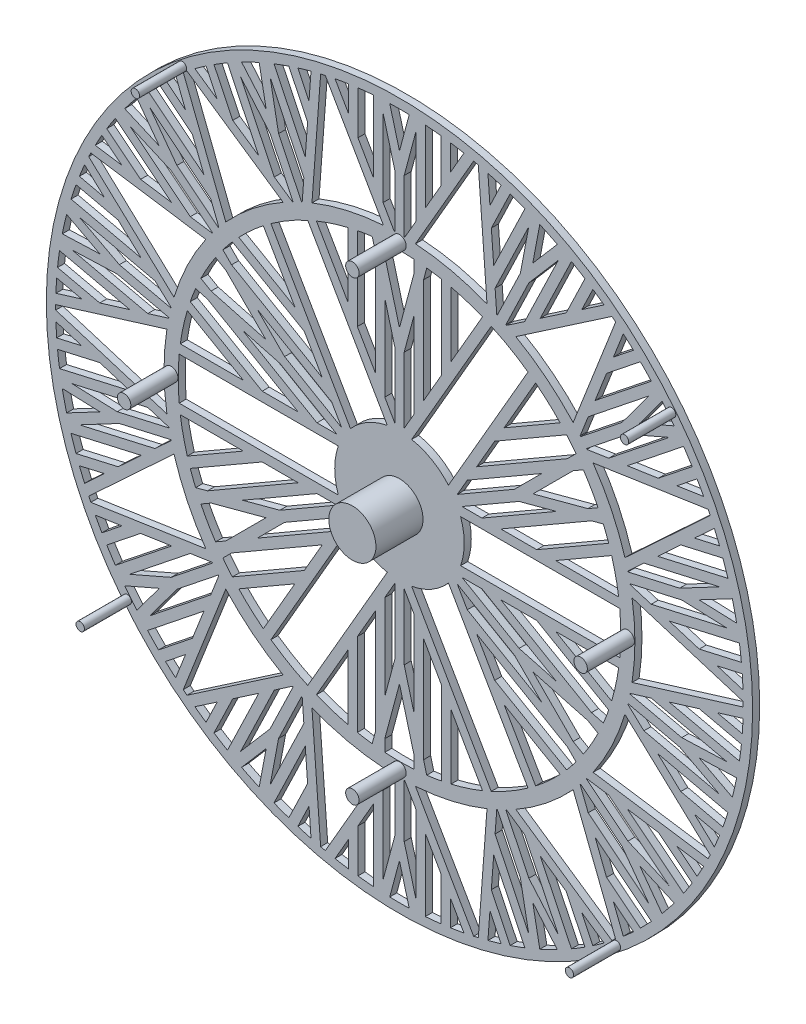
from build123d import *

# Parameters (mm, degrees)
BOSS_EXTRUDE1_OUTLINE_R = 75
BOSS_EXTRUDE1_DEPTH     = 1.5
SKETCH3_R               = 5
SKETCH3_R_2             = 1.426733154
SKETCH3_R_3             = 0.885664415
BOSS_EXTRUDE2_DEPTH     = 10


# Read off the part's stored shape, not the designer's step: Boss-Extrude1
with BuildPart() as part:
    # Boss-Extrude1 outline → Boss-Extrude1 (new body)
    with BuildSketch(Plane.XY):
        Circle(BOSS_EXTRUDE1_OUTLINE_R)
        with BuildLine():
            ThreePointArc((-41.071596258, -60.350012269), (-42.264664679, -59.520568878), (-43.440987533, -58.667543004))
            Line((-43.440987533, -58.667543004), (-38.70706267, -55.440007682))
            Line((-38.70706267, -55.440007682), (-41.071596258, -60.350012269))
        make_face(mode=Mode.SUBTRACT)
        with BuildLine():
            Line((-45.436879204, -50.073158084), (-47.530096096, -55.406587741))
            ThreePointArc((-47.530096096, -55.406587741), (-48.62349129, -54.449573871), (-49.697621503, -53.470986684))
            Line((-49.697621503, -53.470986684), (-45.436879204, -50.073158084))
        make_face(mode=Mode.SUBTRACT)
        with BuildLine():
            ThreePointArc((-55.759999279, -47.114992098), (-57.07369822, -45.514755536), (-58.341487995, -43.877907636))
            Line((-58.341487995, -43.877907636), (-51.010261798, -40.679326344))
            Line((-51.010261798, -40.679326344), (-55.759999279, -47.114992098))
        make_face(mode=Mode.SUBTRACT)
        with BuildLine():
            Line((-41.536752839, -40.13579817), (-43.975515107, -46.349663089))
            Line((-43.975515107, -46.349663089), (-51.15688145, -52.076611644))
            ThreePointArc((-51.15688145, -52.076611644), (-52.339642407, -50.887737547), (-53.494781458, -49.672007778))
            Line((-53.494781458, -49.672007778), (-41.536752839, -40.13579817))
        make_face(mode=Mode.SUBTRACT)
        with BuildLine():
            ThreePointArc((-38.460265225, -31.950086054), (-38.414023041, -32.005668777), (-38.367700529, -32.061184572))
            Line((-38.367700529, -32.061184572), (-40.075388741, -36.412303176))
            Line((-40.075388741, -36.412303176), (-52.956927338, -46.684987415))
            Line((-52.956927338, -46.684987415), (-47.263077046, -38.970094228))
            Line((-47.263077046, -38.970094228), (-38.460265225, -31.950086054))
        make_face(mode=Mode.SUBTRACT)
        with BuildLine():
            Line((-19.211284559, -64.828679594), (-18.78311941, -70.542146446))
            ThreePointArc((-18.78311941, -70.542146446), (-20.183467196, -70.154313138), (-21.575818146, -69.738684181))
            Line((-21.575818146, -69.738684181), (-19.211284559, -64.828679594))
        make_face(mode=Mode.SUBTRACT)
        with BuildLine():
            ThreePointArc((-29.795594485, -66.642498072), (-31.673512955, -65.770727357), (-33.525953761, -64.846051726))
            Line((-33.525953761, -64.846051726), (-28.308559605, -58.783329725))
            Line((-28.308559605, -58.783329725), (-29.795594485, -66.642498072))
        make_face(mode=Mode.SUBTRACT)
        with BuildLine():
            Line((-35.402107573, -53.186727449), (-29.886712879, -49.426395018))
            Line((-29.886712879, -49.426395018), (-36.522918105, -63.206617162))
            ThreePointArc((-36.522918105, -63.206617162), (-37.965209611, -62.350965182), (-39.387465225, -61.462407886))
            Line((-39.387465225, -61.462407886), (-35.402107573, -53.186727449))
        make_face(mode=Mode.SUBTRACT)
        with BuildLine():
            Line((-20.009050999, -54.183226272), (-19.510204933, -60.839864405))
            Line((-19.510204933, -60.839864405), (-23.495562585, -69.115544842))
            ThreePointArc((-23.495562585, -69.115544842), (-25.077026524, -68.55758704), (-26.645256225, -67.963448417))
            Line((-26.645256225, -67.963448417), (-20.009050999, -54.183226272))
        make_face(mode=Mode.SUBTRACT)
        with BuildLine():
            ThreePointArc((-10.819340604, -72.193779988), (-12.254140109, -71.964130302), (-13.684084435, -71.705967905))
            Line((-13.684084435, -71.705967905), (-10.819340604, -66.744086039))
            Line((-10.819340604, -66.744086039), (-10.819340604, -72.193779988))
        make_face(mode=Mode.SUBTRACT)
        with BuildLine():
            ThreePointArc((-18.58540492, -46.417482956), (-11.126046698, -48.746395609), (-3.394919835, -49.884612049))
            Line((-3.394919835, -49.884612049), (-15.748185615, -71.28109602))
            Line((-15.748185615, -71.28109602), (-16.739083505, -71.054930043))
            Line((-16.739083505, -71.054930043), (-18.58540492, -46.417482956))
        make_face(mode=Mode.SUBTRACT)
        with BuildLine():
            Line((-8.819340604, -63.279984424), (-5.481688786, -57.499001897))
            Line((-5.481688786, -57.499001897), (-5.481688786, -72.793894579))
            ThreePointArc((-5.481688786, -72.793894579), (-7.152402012, -72.648765616), (-8.819340604, -72.465296738))
            Line((-8.819340604, -72.465296738), (-8.819340604, -63.279984424))
        make_face(mode=Mode.SUBTRACT)
        with BuildLine():
            ThreePointArc((-1.144573463, -49.986897799), (-1.072287853, -49.988500665), (-1, -49.989999))
            Line((-1, -49.989999), (-1, -61.249217921))
            Line((-1, -61.249217921), (-3.481688786, -70.511006561))
            Line((-3.481688786, -70.511006561), (-3.481688786, -54.034900282))
            Line((-3.481688786, -54.034900282), (-1.144573463, -49.986897799))
        make_face(mode=Mode.SUBTRACT)
        with BuildLine():
            ThreePointArc((-22.719727181, -44.540026906), (-22.655295554, -44.57283459), (-22.590816552, -44.605549066))
            Line((-22.590816552, -44.605549066), (-27.476008558, -54.749754791))
            Line((-27.476008558, -54.749754791), (-33.73047238, -62.017573607))
            Line((-33.73047238, -62.017573607), (-26.581757782, -47.173114785))
            Line((-26.581757782, -47.173114785), (-22.719727181, -44.540026906))
        make_face(mode=Mode.SUBTRACT)
        with BuildLine():
            ThreePointArc((-20.788878817, -45.473316544), (-20.723099609, -45.503331115), (-20.657277067, -45.533250534))
            Line((-20.657277067, -45.533250534), (-20.307971373, -50.194411084))
            Line((-20.307971373, -50.194411084), (-27.456685971, -65.038869905))
            Line((-27.456685971, -65.038869905), (-25.674070822, -55.61752227))
            Line((-25.674070822, -55.61752227), (-20.788878817, -45.473316544))
        make_face(mode=Mode.SUBTRACT)
        with BuildLine():
            ThreePointArc((-36.884662296, -33.75680209), (-31.174490093, -39.091574123), (-24.70283908, -43.471481932))
            Line((-24.70283908, -43.471481932), (-45.116333435, -57.389166725))
            Line((-45.116333435, -57.389166725), (-45.910971845, -56.755463739))
            Line((-45.910971845, -56.755463739), (-36.884662296, -33.75680209))
        make_face(mode=Mode.SUBTRACT)
        with BuildLine():
            Line((-10.938339611, -31.968983445), (-10.938339611, -45.709438047))
            ThreePointArc((-10.938339611, -45.709438047), (-14.326369068, -44.763323707), (-17.634148315, -43.566464318))
            Line((-17.634148315, -43.566464318), (-10.938339611, -31.968983445))
        make_face(mode=Mode.SUBTRACT)
        with BuildLine():
            ThreePointArc((-63.189118562, -36.553184476), (-63.904154068, -35.288228815), (-64.593870282, -34.009291701))
            Line((-64.593870282, -34.009291701), (-58.928376263, -33.155355876))
            Line((-58.928376263, -33.155355876), (-63.189118562, -36.553184476))
        make_face(mode=Mode.SUBTRACT)
        with BuildLine():
            Line((-62.663142676, -25.400033508), (-66.863154332, -29.297074817))
            ThreePointArc((-66.863154332, -29.297074817), (-67.433036606, -27.960428719), (-67.97620142, -26.612704495))
            Line((-67.97620142, -26.612704495), (-62.663142676, -25.400033508))
        make_face(mode=Mode.SUBTRACT)
        with BuildLine():
            Line((-54.837591364, -18.138983008), (-59.730935189, -22.679342557))
            Line((-59.730935189, -22.679342557), (-68.685952546, -24.723266832))
            ThreePointArc((-68.685952546, -24.723266832), (-69.235750208, -23.138947536), (-69.749009154, -21.542416812))
            Line((-69.749009154, -21.542416812), (-54.837591364, -18.138983008))
        make_face(mode=Mode.SUBTRACT)
        with BuildLine():
            Line((-54.973052958, -32.559186811), (-48.372306949, -31.56428443))
            Line((-48.372306949, -31.56428443), (-60.330335569, -41.100494038))
            ThreePointArc((-60.330335569, -41.100494038), (-61.258541834, -39.703791411), (-62.154419302, -38.286135366))
            Line((-62.154419302, -38.286135366), (-54.973052958, -32.559186811))
        make_face(mode=Mode.SUBTRACT)
        with BuildLine():
            ThreePointArc((-39.794960292, -30.271457437), (-39.751144122, -30.328971973), (-39.707244828, -30.386423089))
            Line((-39.707244828, -30.386423089), (-48.510056649, -37.406431263))
            Line((-48.510056649, -37.406431263), (-57.298522241, -41.240799604))
            Line((-57.298522241, -41.240799604), (-44.416983644, -30.968115365))
            Line((-44.416983644, -30.968115365), (-39.794960292, -30.271457437))
        make_face(mode=Mode.SUBTRACT)
        with BuildLine():
            ThreePointArc((-47.878459943, -14.41017257), (-45.048443395, -21.694186956), (-41.118058086, -28.448291675))
            Line((-41.118058086, -28.448291675), (-65.548638102, -32.130609128))
            Line((-65.548638102, -32.130609128), (-65.98962915, -31.214881782))
            Line((-65.98962915, -31.214881782), (-47.878459943, -14.41017257))
        make_face(mode=Mode.SUBTRACT)
        with BuildLine():
            ThreePointArc((-70.680452365, -18.255784111), (-71.169737589, -16.244028179), (-71.601775021, -14.219205812))
            Line((-71.601775021, -14.219205812), (-63.608756042, -14.518283481))
            Line((-63.608756042, -14.518283481), (-70.680452365, -18.255784111))
        make_face(mode=Mode.SUBTRACT)
        with BuildLine():
            ThreePointArc((-48.514124421, -12.098749178), (-48.496578092, -12.168891213), (-48.478930352, -12.239007801))
            Line((-48.478930352, -12.239007801), (-51.905383877, -15.418292056))
            Line((-51.905383877, -15.418292056), (-67.968399772, -19.084570614))
            Line((-67.968399772, -19.084570614), (-59.491051217, -14.604161088))
            Line((-59.491051217, -14.604161088), (-48.514124421, -12.098749178))
        make_face(mode=Mode.SUBTRACT)
        with BuildLine():
            ThreePointArc((-48.988313464, -10.007254567), (-48.973791081, -10.078084498), (-48.959166289, -10.148893354))
            Line((-48.959166289, -10.148893354), (-59.936093085, -12.654305264))
            Line((-59.936093085, -12.654305264), (-69.517897053, -12.295779455))
            Line((-69.517897053, -12.295779455), (-53.454881158, -8.629500898))
            Line((-53.454881158, -8.629500898), (-48.988313464, -10.007254567))
        make_face(mode=Mode.SUBTRACT)
        with BuildLine():
            ThreePointArc((-72.791260972, -5.516550202), (-72.88664201, -4.066622254), (-72.953144829, -2.61508308))
            Line((-72.953144829, -2.61508308), (-67.478202228, -4.303879215))
            Line((-67.478202228, -4.303879215), (-72.791260972, -5.516550202))
        make_face(mode=Mode.SUBTRACT)
        with BuildLine():
            Line((-63.655911005, -5.482899913), (-57.277172381, -7.4504802))
            Line((-57.277172381, -7.4504802), (-72.18859017, -10.853914004))
            ThreePointArc((-72.18859017, -10.853914004), (-72.41886856, -9.192794814), (-72.610928362, -7.526824187))
            Line((-72.610928362, -7.526824187), (-63.655911005, -5.482899913))
        make_face(mode=Mode.SUBTRACT)
        with BuildLine():
            Line((-33.155121602, -6.511611744), (-45.054704347, -13.381839045))
            ThreePointArc((-45.054704347, -13.381839045), (-45.929360022, -9.974662297), (-46.54673901, -6.511611744))
            Line((-46.54673901, -6.511611744), (-33.155121602, -6.511611744))
        make_face(mode=Mode.SUBTRACT)
        with BuildLine():
            Line((-22.216781991, -25.457371701), (-28.912590695, -37.054852574))
            ThreePointArc((-28.912590695, -37.054852574), (-31.602990954, -34.788661411), (-34.116364736, -32.327599002))
            Line((-34.116364736, -32.327599002), (-22.216781991, -25.457371701))
        make_face(mode=Mode.SUBTRACT)
        with BuildLine():
            Line((-42.173878398, -20.745215855), (-40.007982856, -19.494735481))
            Line((-40.007982856, -19.494735481), (-28.360046048, -16.37368022))
            Line((-28.360046048, -16.37368022), (-36.886927595, -24.900561767))
            Line((-36.886927595, -24.900561767), (-39.052823137, -26.151042141))
            ThreePointArc((-39.052823137, -26.151042141), (-40.703193978, -23.5), (-42.173878398, -20.745215855))
        make_face(mode=Mode.SUBTRACT)
        with BuildLine():
            Line((-20.216781991, -21.993270086), (-35.49118009, -30.81194794))
            ThreePointArc((-35.49118009, -30.81194794), (-36.514562649, -29.592004234), (-37.496032399, -28.338093696))
            Line((-37.496032399, -28.338093696), (-35.65889878, -26.500960077))
            Line((-35.65889878, -26.500960077), (-16.399497641, -15.381539645))
            Line((-16.399497641, -15.381539645), (-20.216781991, -21.993270086))
        make_face(mode=Mode.SUBTRACT)
        with BuildLine():
            Line((-8.938339611, -28.50488183), (-5.121055261, -21.893151389))
            Line((-5.121055261, -21.893151389), (-5.121055261, -44.131992253))
            Line((-5.121055261, -44.131992253), (-5.793492836, -46.641563447))
            ThreePointArc((-5.793492836, -46.641563447), (-7.370146091, -46.418540979), (-8.938339611, -46.142237538))
            Line((-8.938339611, -46.142237538), (-8.938339611, -28.50488183))
        make_face(mode=Mode.SUBTRACT)
        with BuildLine():
            Line((-2.586327374, -13.502873905), (-19.484309688, -42.771037818))
            ThreePointArc((-19.484309688, -42.771037818), (-23.5, -40.703193978), (-27.298650452, -38.259426074))
            Line((-27.298650452, -38.259426074), (-10.400668139, -8.991262161))
            ThreePointArc((-10.400668139, -8.991262161), (-6.874167095, -11.906406668), (-2.586327374, -13.502873905))
        make_face(mode=Mode.SUBTRACT)
        Polygon((-1, -28.752004637), (-3.121055261, -36.667890638), (-3.121055261, -18.429049774), (-1, -14.755274296), align=None, mode=Mode.SUBTRACT)
        with BuildLine():
            Line((-29.155121602, -6.511611744), (-21.520552902, -6.511611744))
            Line((-21.520552902, -6.511611744), (-40.779954041, -17.631032176))
            Line((-40.779954041, -17.631032176), (-43.289525235, -18.303469751))
            ThreePointArc((-43.289525235, -18.303469751), (-43.88470874, -16.826536745), (-44.429519701, -15.330289598))
            Line((-44.429519701, -15.330289598), (-29.155121602, -6.511611744))
        make_face(mode=Mode.SUBTRACT)
        Polygon((-12.27844238, -8.243662552), (-14.399497641, -11.91743803), (-30.194797165, -21.036858462), (-24.399966425, -15.242027722), align=None, mode=Mode.SUBTRACT)
        Polygon((-25.399966425, -13.509976915), (-33.315852426, -15.631032176), (-17.520552902, -6.511611744), (-13.27844238, -6.511611744), align=None, mode=Mode.SUBTRACT)
        with BuildLine():
            ThreePointArc((2.070193216, -72.970639987), (0, -73), (-2.070193216, -72.970639987))
            Line((-2.070193216, -72.970639987), (0, -65.244573724))
            Line((0, -65.244573724), (2.070193216, -72.970639987))
        make_face(mode=Mode.SUBTRACT)
        with BuildLine():
            Line((10.819340604, -66.744086039), (13.684084435, -71.705967905))
            ThreePointArc((13.684084435, -71.705967905), (12.254140109, -71.964130302), (10.819340604, -72.193779988))
            Line((10.819340604, -72.193779988), (10.819340604, -66.744086039))
        make_face(mode=Mode.SUBTRACT)
        with BuildLine():
            Line((5.481688786, -57.499001897), (8.819340604, -63.279984424))
            Line((8.819340604, -63.279984424), (8.819340604, -72.465296738))
            ThreePointArc((8.819340604, -72.465296738), (7.152402012, -72.648765616), (5.481688786, -72.793894579))
            Line((5.481688786, -72.793894579), (5.481688786, -57.499001897))
        make_face(mode=Mode.SUBTRACT)
        with BuildLine():
            ThreePointArc((1, -49.989999), (1.072287853, -49.988500665), (1.144573463, -49.986897799))
            Line((1.144573463, -49.986897799), (3.481688786, -54.034900282))
            Line((3.481688786, -54.034900282), (3.481688786, -70.511006561))
            Line((3.481688786, -70.511006561), (1, -61.249217921))
            Line((1, -61.249217921), (1, -49.989999))
        make_face(mode=Mode.SUBTRACT)
        with BuildLine():
            ThreePointArc((3.394919835, -49.884612049), (11.126046698, -48.746395609), (18.58540492, -46.417482956))
            Line((18.58540492, -46.417482956), (16.739083505, -71.054930043))
            Line((16.739083505, -71.054930043), (15.748185615, -71.28109602))
            Line((15.748185615, -71.28109602), (3.394919835, -49.884612049))
        make_face(mode=Mode.SUBTRACT)
        with BuildLine():
            ThreePointArc((21.575818146, -69.738684181), (20.183467196, -70.154313138), (18.78311941, -70.542146446))
            Line((18.78311941, -70.542146446), (19.211284559, -64.828679594))
            Line((19.211284559, -64.828679594), (21.575818146, -69.738684181))
        make_face(mode=Mode.SUBTRACT)
        with BuildLine():
            Line((19.510204933, -60.839864405), (20.009050999, -54.183226272))
            Line((20.009050999, -54.183226272), (26.645256225, -67.963448417))
            ThreePointArc((26.645256225, -67.963448417), (25.077026524, -68.55758704), (23.495562585, -69.115544842))
            Line((23.495562585, -69.115544842), (19.510204933, -60.839864405))
        make_face(mode=Mode.SUBTRACT)
        with BuildLine():
            ThreePointArc((33.525953761, -64.846051726), (31.673512955, -65.770727357), (29.795594485, -66.642498072))
            Line((29.795594485, -66.642498072), (28.308559605, -58.783329725))
            Line((28.308559605, -58.783329725), (33.525953761, -64.846051726))
        make_face(mode=Mode.SUBTRACT)
        with BuildLine():
            Line((29.886712879, -49.426395018), (35.402107573, -53.186727449))
            Line((35.402107573, -53.186727449), (39.387465225, -61.462407886))
            ThreePointArc((39.387465225, -61.462407886), (37.965209611, -62.350965182), (36.522918105, -63.206617162))
            Line((36.522918105, -63.206617162), (29.886712879, -49.426395018))
        make_face(mode=Mode.SUBTRACT)
        with BuildLine():
            Line((-3.121055261, -46.896257996), (-3.121055261, -44.395297248))
            Line((-3.121055261, -44.395297248), (0, -32.74736044))
            Line((0, -32.74736044), (3.121055261, -44.395297248))
            Line((3.121055261, -44.395297248), (3.121055261, -46.896257996))
            ThreePointArc((3.121055261, -46.896257996), (0, -47), (-3.121055261, -46.896257996))
        make_face(mode=Mode.SUBTRACT)
        with BuildLine():
            Line((10.938339611, -31.968983445), (17.634148315, -43.566464318))
            ThreePointArc((17.634148315, -43.566464318), (14.326369068, -44.763323707), (10.938339611, -45.709438047))
            Line((10.938339611, -45.709438047), (10.938339611, -31.968983445))
        make_face(mode=Mode.SUBTRACT)
        with BuildLine():
            ThreePointArc((20.657277067, -45.533250534), (20.723099609, -45.503331115), (20.788878817, -45.473316544))
            Line((20.788878817, -45.473316544), (25.674070822, -55.61752227))
            Line((25.674070822, -55.61752227), (27.456685971, -65.038869905))
            Line((27.456685971, -65.038869905), (20.307971373, -50.194411084))
            Line((20.307971373, -50.194411084), (20.657277067, -45.533250534))
        make_face(mode=Mode.SUBTRACT)
        with BuildLine():
            ThreePointArc((22.590816552, -44.605549066), (22.655295554, -44.57283459), (22.719727181, -44.540026906))
            Line((22.719727181, -44.540026906), (26.581757782, -47.173114785))
            Line((26.581757782, -47.173114785), (33.73047238, -62.017573607))
            Line((33.73047238, -62.017573607), (27.476008558, -54.749754791))
            Line((27.476008558, -54.749754791), (22.590816552, -44.605549066))
        make_face(mode=Mode.SUBTRACT)
        with BuildLine():
            ThreePointArc((24.70283908, -43.471481932), (31.174490093, -39.091574123), (36.884662296, -33.75680209))
            Line((36.884662296, -33.75680209), (45.910971845, -56.755463739))
            Line((45.910971845, -56.755463739), (45.116333435, -57.389166725))
            Line((45.116333435, -57.389166725), (24.70283908, -43.471481932))
        make_face(mode=Mode.SUBTRACT)
        with BuildLine():
            Line((38.70706267, -55.440007682), (43.440987533, -58.667543004))
            ThreePointArc((43.440987533, -58.667543004), (42.264664679, -59.520568878), (41.071596258, -60.350012269))
            Line((41.071596258, -60.350012269), (38.70706267, -55.440007682))
        make_face(mode=Mode.SUBTRACT)
        with BuildLine():
            ThreePointArc((49.697621503, -53.470986684), (48.62349129, -54.449573871), (47.530096096, -55.406587741))
            Line((47.530096096, -55.406587741), (45.436879204, -50.073158084))
            Line((45.436879204, -50.073158084), (49.697621503, -53.470986684))
        make_face(mode=Mode.SUBTRACT)
        with BuildLine():
            ThreePointArc((38.367700529, -32.061184572), (38.414023041, -32.005668777), (38.460265225, -31.950086054))
            Line((38.460265225, -31.950086054), (47.263077046, -38.970094228))
            Line((47.263077046, -38.970094228), (52.956927338, -46.684987415))
            Line((52.956927338, -46.684987415), (40.075388741, -36.412303176))
            Line((40.075388741, -36.412303176), (38.367700529, -32.061184572))
        make_face(mode=Mode.SUBTRACT)
        with BuildLine():
            Line((43.975515107, -46.349663089), (41.536752839, -40.13579817))
            Line((41.536752839, -40.13579817), (53.494781458, -49.672007778))
            ThreePointArc((53.494781458, -49.672007778), (52.339642407, -50.887737547), (51.15688145, -52.076611644))
            Line((51.15688145, -52.076611644), (43.975515107, -46.349663089))
        make_face(mode=Mode.SUBTRACT)
        with BuildLine():
            ThreePointArc((58.341487995, -43.877907636), (57.07369822, -45.514755536), (55.759999279, -47.114992098))
            Line((55.759999279, -47.114992098), (51.010261798, -40.679326344))
            Line((51.010261798, -40.679326344), (58.341487995, -43.877907636))
        make_face(mode=Mode.SUBTRACT)
        with BuildLine():
            Line((8.938339611, -28.50488183), (8.938339611, -46.142237538))
            ThreePointArc((8.938339611, -46.142237538), (7.370146091, -46.418540979), (5.793492836, -46.641563447))
            Line((5.793492836, -46.641563447), (5.121055261, -44.131992253))
            Line((5.121055261, -44.131992253), (5.121055261, -21.893151389))
            Line((5.121055261, -21.893151389), (8.938339611, -28.50488183))
        make_face(mode=Mode.SUBTRACT)
        Polygon((1, -14.755274296), (3.121055261, -18.429049774), (3.121055261, -36.667890638), (1, -28.752004637), align=None, mode=Mode.SUBTRACT)
        with BuildLine():
            Line((10.400668139, -8.991262161), (27.298650452, -38.259426074))
            ThreePointArc((27.298650452, -38.259426074), (23.5, -40.703193978), (19.484309688, -42.771037818))
            Line((19.484309688, -42.771037818), (2.586327374, -13.502873905))
            ThreePointArc((2.586327374, -13.502873905), (6.874167095, -11.906406668), (10.400668139, -8.991262161))
        make_face(mode=Mode.SUBTRACT)
        with BuildLine():
            Line((22.216781991, -25.457371701), (34.116364736, -32.327599002))
            ThreePointArc((34.116364736, -32.327599002), (31.602990954, -34.788661411), (28.912590695, -37.054852574))
            Line((28.912590695, -37.054852574), (22.216781991, -25.457371701))
        make_face(mode=Mode.SUBTRACT)
        with BuildLine():
            Line((20.216781991, -21.993270086), (16.399497641, -15.381539645))
            Line((16.399497641, -15.381539645), (35.65889878, -26.500960077))
            Line((35.65889878, -26.500960077), (37.496032399, -28.338093696))
            ThreePointArc((37.496032399, -28.338093696), (36.514562649, -29.592004234), (35.49118009, -30.81194794))
            Line((35.49118009, -30.81194794), (20.216781991, -21.993270086))
        make_face(mode=Mode.SUBTRACT)
        with BuildLine():
            Line((39.052823137, -26.151042141), (36.886927595, -24.900561767))
            Line((36.886927595, -24.900561767), (28.360046048, -16.37368022))
            Line((28.360046048, -16.37368022), (40.007982856, -19.494735481))
            Line((40.007982856, -19.494735481), (42.173878398, -20.745215855))
            ThreePointArc((42.173878398, -20.745215855), (40.703193978, -23.5), (39.052823137, -26.151042141))
        make_face(mode=Mode.SUBTRACT)
        Polygon((24.399966425, -15.242027722), (30.194797165, -21.036858462), (14.399497641, -11.91743803), (12.27844238, -8.243662552), align=None, mode=Mode.SUBTRACT)
        Polygon((13.27844238, -6.511611744), (17.520552902, -6.511611744), (33.315852426, -15.631032176), (25.399966425, -13.509976915), align=None, mode=Mode.SUBTRACT)
        with BuildLine():
            Line((29.155121602, -6.511611744), (44.429519701, -15.330289598))
            ThreePointArc((44.429519701, -15.330289598), (43.88470874, -16.826536745), (43.289525235, -18.303469751))
            Line((43.289525235, -18.303469751), (40.779954041, -17.631032176))
            Line((40.779954041, -17.631032176), (21.520552902, -6.511611744))
            Line((21.520552902, -6.511611744), (29.155121602, -6.511611744))
        make_face(mode=Mode.SUBTRACT)
        with BuildLine():
            ThreePointArc((39.707244828, -30.386423089), (39.751144122, -30.328971973), (39.794960292, -30.271457437))
            Line((39.794960292, -30.271457437), (44.416983644, -30.968115365))
            Line((44.416983644, -30.968115365), (57.298522241, -41.240799604))
            Line((57.298522241, -41.240799604), (48.510056649, -37.406431263))
            Line((48.510056649, -37.406431263), (39.707244828, -30.386423089))
        make_face(mode=Mode.SUBTRACT)
        with BuildLine():
            Line((48.372306949, -31.56428443), (54.973052958, -32.559186811))
            Line((54.973052958, -32.559186811), (62.154419302, -38.286135366))
            ThreePointArc((62.154419302, -38.286135366), (61.258541834, -39.703791411), (60.330335569, -41.100494038))
            Line((60.330335569, -41.100494038), (48.372306949, -31.56428443))
        make_face(mode=Mode.SUBTRACT)
        with BuildLine():
            ThreePointArc((41.118058086, -28.448291675), (45.048443395, -21.694186956), (47.878459943, -14.41017257))
            Line((47.878459943, -14.41017257), (65.98962915, -31.214881782))
            Line((65.98962915, -31.214881782), (65.548638102, -32.130609128))
            Line((65.548638102, -32.130609128), (41.118058086, -28.448291675))
        make_face(mode=Mode.SUBTRACT)
        with BuildLine():
            Line((58.928376263, -33.155355876), (64.593870282, -34.009291701))
            ThreePointArc((64.593870282, -34.009291701), (63.904154068, -35.288228815), (63.189118562, -36.553184476))
            Line((63.189118562, -36.553184476), (58.928376263, -33.155355876))
        make_face(mode=Mode.SUBTRACT)
        with BuildLine():
            ThreePointArc((67.97620142, -26.612704495), (67.433036606, -27.960428719), (66.863154332, -29.297074817))
            Line((66.863154332, -29.297074817), (62.663142676, -25.400033508))
            Line((62.663142676, -25.400033508), (67.97620142, -26.612704495))
        make_face(mode=Mode.SUBTRACT)
        with BuildLine():
            Line((59.730935189, -22.679342557), (54.837591364, -18.138983008))
            Line((54.837591364, -18.138983008), (69.749009154, -21.542416812))
            ThreePointArc((69.749009154, -21.542416812), (69.235750208, -23.138947536), (68.685952546, -24.723266832))
            Line((68.685952546, -24.723266832), (59.730935189, -22.679342557))
        make_face(mode=Mode.SUBTRACT)
        with BuildLine():
            Line((33.155121602, -6.511611744), (46.54673901, -6.511611744))
            ThreePointArc((46.54673901, -6.511611744), (45.929360022, -9.974662297), (45.054704347, -13.381839045))
            Line((45.054704347, -13.381839045), (33.155121602, -6.511611744))
        make_face(mode=Mode.SUBTRACT)
        with BuildLine():
            ThreePointArc((48.478930352, -12.239007801), (48.496578092, -12.168891213), (48.514124421, -12.098749178))
            Line((48.514124421, -12.098749178), (59.491051217, -14.604161088))
            Line((59.491051217, -14.604161088), (67.968399772, -19.084570614))
            Line((67.968399772, -19.084570614), (51.905383877, -15.418292056))
            Line((51.905383877, -15.418292056), (48.478930352, -12.239007801))
        make_face(mode=Mode.SUBTRACT)
        with BuildLine():
            ThreePointArc((48.959166289, -10.148893354), (48.973791081, -10.078084498), (48.988313464, -10.007254567))
            Line((48.988313464, -10.007254567), (53.454881158, -8.629500898))
            Line((53.454881158, -8.629500898), (69.517897053, -12.295779455))
            Line((69.517897053, -12.295779455), (59.936093085, -12.654305264))
            Line((59.936093085, -12.654305264), (48.959166289, -10.148893354))
        make_face(mode=Mode.SUBTRACT)
        with BuildLine():
            ThreePointArc((71.601775021, -14.219205812), (71.169737589, -16.244028179), (70.680452365, -18.255784111))
            Line((70.680452365, -18.255784111), (63.608756042, -14.518283481))
            Line((63.608756042, -14.518283481), (71.601775021, -14.219205812))
        make_face(mode=Mode.SUBTRACT)
        with BuildLine():
            Line((57.277172381, -7.4504802), (63.655911005, -5.482899913))
            Line((63.655911005, -5.482899913), (72.610928362, -7.526824187))
            ThreePointArc((72.610928362, -7.526824187), (72.41886856, -9.192794814), (72.18859017, -10.853914004))
            Line((72.18859017, -10.853914004), (57.277172381, -7.4504802))
        make_face(mode=Mode.SUBTRACT)
        with BuildLine():
            Line((67.478202228, -4.303879215), (72.953144829, -2.61508308))
            ThreePointArc((72.953144829, -2.61508308), (72.88664201, -4.066622254), (72.791260972, -5.516550202))
            Line((72.791260972, -5.516550202), (67.478202228, -4.303879215))
        make_face(mode=Mode.SUBTRACT)
        with BuildLine():
            Line((-67.478202228, 4.303879215), (-72.953144829, 2.61508308))
            ThreePointArc((-72.953144829, 2.61508308), (-72.88664201, 4.066622254), (-72.791260972, 5.516550202))
            Line((-72.791260972, 5.516550202), (-67.478202228, 4.303879215))
        make_face(mode=Mode.SUBTRACT)
        with BuildLine():
            ThreePointArc((-49.389341408, 7.790568357), (-50, 0), (-49.389341408, -7.790568357))
            Line((-49.389341408, -7.790568357), (-72.998231092, -0.508190338))
            Line((-72.998231092, -0.508190338), (-72.998231092, 0.508190338))
            Line((-72.998231092, 0.508190338), (-49.389341408, 7.790568357))
        make_face(mode=Mode.SUBTRACT)
        with BuildLine():
            Line((-57.277172381, 7.4504802), (-63.655911005, 5.482899913))
            Line((-63.655911005, 5.482899913), (-72.610928362, 7.526824187))
            ThreePointArc((-72.610928362, 7.526824187), (-72.41886856, 9.192794814), (-72.18859017, 10.853914004))
            Line((-72.18859017, 10.853914004), (-57.277172381, 7.4504802))
        make_face(mode=Mode.SUBTRACT)
        with BuildLine():
            ThreePointArc((-71.601775021, 14.219205812), (-71.169737589, 16.244028179), (-70.680452365, 18.255784111))
            Line((-70.680452365, 18.255784111), (-63.608756042, 14.518283481))
            Line((-63.608756042, 14.518283481), (-71.601775021, 14.219205812))
        make_face(mode=Mode.SUBTRACT)
        with BuildLine():
            ThreePointArc((-48.959166289, 10.148893354), (-48.973791081, 10.078084498), (-48.988313464, 10.007254567))
            Line((-48.988313464, 10.007254567), (-53.454881158, 8.629500898))
            Line((-53.454881158, 8.629500898), (-69.517897053, 12.295779455))
            Line((-69.517897053, 12.295779455), (-59.936093085, 12.654305264))
            Line((-59.936093085, 12.654305264), (-48.959166289, 10.148893354))
        make_face(mode=Mode.SUBTRACT)
        with BuildLine():
            ThreePointArc((-48.478930352, 12.239007801), (-48.496578092, 12.168891213), (-48.514124421, 12.098749178))
            Line((-48.514124421, 12.098749178), (-59.491051217, 14.604161088))
            Line((-59.491051217, 14.604161088), (-67.968399772, 19.084570614))
            Line((-67.968399772, 19.084570614), (-51.905383877, 15.418292056))
            Line((-51.905383877, 15.418292056), (-48.478930352, 12.239007801))
        make_face(mode=Mode.SUBTRACT)
        with BuildLine():
            Line((-33.155121602, 6.511611744), (-46.54673901, 6.511611744))
            ThreePointArc((-46.54673901, 6.511611744), (-45.929360022, 9.974662297), (-45.054704347, 13.381839045))
            Line((-45.054704347, 13.381839045), (-33.155121602, 6.511611744))
        make_face(mode=Mode.SUBTRACT)
        with BuildLine():
            Line((-59.730935189, 22.679342557), (-54.837591364, 18.138983008))
            Line((-54.837591364, 18.138983008), (-69.749009154, 21.542416812))
            ThreePointArc((-69.749009154, 21.542416812), (-69.235750208, 23.138947536), (-68.685952546, 24.723266832))
            Line((-68.685952546, 24.723266832), (-59.730935189, 22.679342557))
        make_face(mode=Mode.SUBTRACT)
        with BuildLine():
            ThreePointArc((-67.97620142, 26.612704495), (-67.433036606, 27.960428719), (-66.863154332, 29.297074817))
            Line((-66.863154332, 29.297074817), (-62.663142676, 25.400033508))
            Line((-62.663142676, 25.400033508), (-67.97620142, 26.612704495))
        make_face(mode=Mode.SUBTRACT)
        with BuildLine():
            Line((-58.928376263, 33.155355876), (-64.593870282, 34.009291701))
            ThreePointArc((-64.593870282, 34.009291701), (-63.904154068, 35.288228815), (-63.189118562, 36.553184476))
            Line((-63.189118562, 36.553184476), (-58.928376263, 33.155355876))
        make_face(mode=Mode.SUBTRACT)
        with BuildLine():
            ThreePointArc((-41.118058086, 28.448291675), (-45.048443395, 21.694186956), (-47.878459943, 14.41017257))
            Line((-47.878459943, 14.41017257), (-65.98962915, 31.214881782))
            Line((-65.98962915, 31.214881782), (-65.548638102, 32.130609128))
            Line((-65.548638102, 32.130609128), (-41.118058086, 28.448291675))
        make_face(mode=Mode.SUBTRACT)
        with BuildLine():
            Line((-48.372306949, 31.56428443), (-54.973052958, 32.559186811))
            Line((-54.973052958, 32.559186811), (-62.154419302, 38.286135366))
            ThreePointArc((-62.154419302, 38.286135366), (-61.258541834, 39.703791411), (-60.330335569, 41.100494038))
            Line((-60.330335569, 41.100494038), (-48.372306949, 31.56428443))
        make_face(mode=Mode.SUBTRACT)
        with BuildLine():
            ThreePointArc((-39.707244828, 30.386423089), (-39.751144122, 30.328971973), (-39.794960292, 30.271457437))
            Line((-39.794960292, 30.271457437), (-44.416983644, 30.968115365))
            Line((-44.416983644, 30.968115365), (-57.298522241, 41.240799604))
            Line((-57.298522241, 41.240799604), (-48.510056649, 37.406431263))
            Line((-48.510056649, 37.406431263), (-39.707244828, 30.386423089))
        make_face(mode=Mode.SUBTRACT)
        with BuildLine():
            Line((-12.986995513, -4.511611744), (-46.78296014, -4.511611744))
            ThreePointArc((-46.78296014, -4.511611744), (-47, 0), (-46.78296014, 4.511611744))
            Line((-46.78296014, 4.511611744), (-12.986995513, 4.511611744))
            ThreePointArc((-12.986995513, 4.511611744), (-13.74833419, 0), (-12.986995513, -4.511611744))
        make_face(mode=Mode.SUBTRACT)
        with BuildLine():
            Line((-29.155121602, 6.511611744), (-44.429519701, 15.330289598))
            ThreePointArc((-44.429519701, 15.330289598), (-43.88470874, 16.826536745), (-43.289525235, 18.303469751))
            Line((-43.289525235, 18.303469751), (-40.779954041, 17.631032176))
            Line((-40.779954041, 17.631032176), (-21.520552902, 6.511611744))
            Line((-21.520552902, 6.511611744), (-29.155121602, 6.511611744))
        make_face(mode=Mode.SUBTRACT)
        Polygon((-13.27844238, 6.511611744), (-17.520552902, 6.511611744), (-33.315852426, 15.631032176), (-25.399966425, 13.509976915), align=None, mode=Mode.SUBTRACT)
        Polygon((-24.399966425, 15.242027722), (-30.194797165, 21.036858462), (-14.399497641, 11.91743803), (-12.27844238, 8.243662552), align=None, mode=Mode.SUBTRACT)
        with BuildLine():
            Line((-39.052823137, 26.151042141), (-36.886927595, 24.900561767))
            Line((-36.886927595, 24.900561767), (-28.360046048, 16.37368022))
            Line((-28.360046048, 16.37368022), (-40.007982856, 19.494735481))
            Line((-40.007982856, 19.494735481), (-42.173878398, 20.745215855))
            ThreePointArc((-42.173878398, 20.745215855), (-40.703193978, 23.5), (-39.052823137, 26.151042141))
        make_face(mode=Mode.SUBTRACT)
        with BuildLine():
            Line((-20.216781991, 21.993270086), (-16.399497641, 15.381539645))
            Line((-16.399497641, 15.381539645), (-35.65889878, 26.500960077))
            Line((-35.65889878, 26.500960077), (-37.496032399, 28.338093696))
            ThreePointArc((-37.496032399, 28.338093696), (-36.514562649, 29.592004234), (-35.49118009, 30.81194794))
            Line((-35.49118009, 30.81194794), (-20.216781991, 21.993270086))
        make_face(mode=Mode.SUBTRACT)
        with BuildLine():
            Line((-22.216781991, 25.457371701), (-34.116364736, 32.327599002))
            ThreePointArc((-34.116364736, 32.327599002), (-31.602990954, 34.788661411), (-28.912590695, 37.054852574))
            Line((-28.912590695, 37.054852574), (-22.216781991, 25.457371701))
        make_face(mode=Mode.SUBTRACT)
        with BuildLine():
            Line((-10.400668139, 8.991262161), (-27.298650452, 38.259426074))
            ThreePointArc((-27.298650452, 38.259426074), (-23.5, 40.703193978), (-19.484309688, 42.771037818))
            Line((-19.484309688, 42.771037818), (-2.586327374, 13.502873905))
            ThreePointArc((-2.586327374, 13.502873905), (-6.874167095, 11.906406668), (-10.400668139, 8.991262161))
        make_face(mode=Mode.SUBTRACT)
        Polygon((-1, 14.755274296), (-3.121055261, 18.429049774), (-3.121055261, 36.667890638), (-1, 28.752004637), align=None, mode=Mode.SUBTRACT)
        with BuildLine():
            Line((-8.938339611, 28.50488183), (-8.938339611, 46.142237538))
            ThreePointArc((-8.938339611, 46.142237538), (-7.370146091, 46.418540979), (-5.793492836, 46.641563447))
            Line((-5.793492836, 46.641563447), (-5.121055261, 44.131992253))
            Line((-5.121055261, 44.131992253), (-5.121055261, 21.893151389))
            Line((-5.121055261, 21.893151389), (-8.938339611, 28.50488183))
        make_face(mode=Mode.SUBTRACT)
        with BuildLine():
            ThreePointArc((-58.341487995, 43.877907636), (-57.07369822, 45.514755536), (-55.759999279, 47.114992098))
            Line((-55.759999279, 47.114992098), (-51.010261798, 40.679326344))
            Line((-51.010261798, 40.679326344), (-58.341487995, 43.877907636))
        make_face(mode=Mode.SUBTRACT)
        with BuildLine():
            Line((-43.975515107, 46.349663089), (-41.536752839, 40.13579817))
            Line((-41.536752839, 40.13579817), (-53.494781458, 49.672007778))
            ThreePointArc((-53.494781458, 49.672007778), (-52.339642407, 50.887737547), (-51.15688145, 52.076611644))
            Line((-51.15688145, 52.076611644), (-43.975515107, 46.349663089))
        make_face(mode=Mode.SUBTRACT)
        with BuildLine():
            ThreePointArc((-38.367700529, 32.061184572), (-38.414023041, 32.005668777), (-38.460265225, 31.950086054))
            Line((-38.460265225, 31.950086054), (-47.263077046, 38.970094228))
            Line((-47.263077046, 38.970094228), (-52.956927338, 46.684987415))
            Line((-52.956927338, 46.684987415), (-40.075388741, 36.412303176))
            Line((-40.075388741, 36.412303176), (-38.367700529, 32.061184572))
        make_face(mode=Mode.SUBTRACT)
        with BuildLine():
            ThreePointArc((-49.697621503, 53.470986684), (-48.62349129, 54.449573871), (-47.530096096, 55.406587741))
            Line((-47.530096096, 55.406587741), (-45.436879204, 50.073158084))
            Line((-45.436879204, 50.073158084), (-49.697621503, 53.470986684))
        make_face(mode=Mode.SUBTRACT)
        with BuildLine():
            Line((-38.70706267, 55.440007682), (-43.440987533, 58.667543004))
            ThreePointArc((-43.440987533, 58.667543004), (-42.264664679, 59.520568878), (-41.071596258, 60.350012269))
            Line((-41.071596258, 60.350012269), (-38.70706267, 55.440007682))
        make_face(mode=Mode.SUBTRACT)
        with BuildLine():
            ThreePointArc((-24.70283908, 43.471481932), (-31.174490093, 39.091574123), (-36.884662296, 33.75680209))
            Line((-36.884662296, 33.75680209), (-45.910971845, 56.755463739))
            Line((-45.910971845, 56.755463739), (-45.116333435, 57.389166725))
            Line((-45.116333435, 57.389166725), (-24.70283908, 43.471481932))
        make_face(mode=Mode.SUBTRACT)
        with BuildLine():
            ThreePointArc((-22.590816552, 44.605549066), (-22.655295554, 44.57283459), (-22.719727181, 44.540026906))
            Line((-22.719727181, 44.540026906), (-26.581757782, 47.173114785))
            Line((-26.581757782, 47.173114785), (-33.73047238, 62.017573607))
            Line((-33.73047238, 62.017573607), (-27.476008558, 54.749754791))
            Line((-27.476008558, 54.749754791), (-22.590816552, 44.605549066))
        make_face(mode=Mode.SUBTRACT)
        with BuildLine():
            ThreePointArc((-20.657277067, 45.533250534), (-20.723099609, 45.503331115), (-20.788878817, 45.473316544))
            Line((-20.788878817, 45.473316544), (-25.674070822, 55.61752227))
            Line((-25.674070822, 55.61752227), (-27.456685971, 65.038869905))
            Line((-27.456685971, 65.038869905), (-20.307971373, 50.194411084))
            Line((-20.307971373, 50.194411084), (-20.657277067, 45.533250534))
        make_face(mode=Mode.SUBTRACT)
        with BuildLine():
            Line((-10.938339611, 31.968983445), (-17.634148315, 43.566464318))
            ThreePointArc((-17.634148315, 43.566464318), (-14.326369068, 44.763323707), (-10.938339611, 45.709438047))
            Line((-10.938339611, 45.709438047), (-10.938339611, 31.968983445))
        make_face(mode=Mode.SUBTRACT)
        with BuildLine():
            Line((-29.886712879, 49.426395018), (-35.402107573, 53.186727449))
            Line((-35.402107573, 53.186727449), (-39.387465225, 61.462407886))
            ThreePointArc((-39.387465225, 61.462407886), (-37.965209611, 62.350965182), (-36.522918105, 63.206617162))
            Line((-36.522918105, 63.206617162), (-29.886712879, 49.426395018))
        make_face(mode=Mode.SUBTRACT)
        with BuildLine():
            ThreePointArc((-33.525953761, 64.846051726), (-31.673512955, 65.770727357), (-29.795594485, 66.642498072))
            Line((-29.795594485, 66.642498072), (-28.308559605, 58.783329725))
            Line((-28.308559605, 58.783329725), (-33.525953761, 64.846051726))
        make_face(mode=Mode.SUBTRACT)
        with BuildLine():
            Line((-19.510204933, 60.839864405), (-20.009050999, 54.183226272))
            Line((-20.009050999, 54.183226272), (-26.645256225, 67.963448417))
            ThreePointArc((-26.645256225, 67.963448417), (-25.077026524, 68.55758704), (-23.495562585, 69.115544842))
            Line((-23.495562585, 69.115544842), (-19.510204933, 60.839864405))
        make_face(mode=Mode.SUBTRACT)
        with BuildLine():
            ThreePointArc((-21.575818146, 69.738684181), (-20.183467196, 70.154313138), (-18.78311941, 70.542146446))
            Line((-18.78311941, 70.542146446), (-19.211284559, 64.828679594))
            Line((-19.211284559, 64.828679594), (-21.575818146, 69.738684181))
        make_face(mode=Mode.SUBTRACT)
        with BuildLine():
            Line((-18.58540492, 46.417482956), (-16.739083505, 71.054930043))
            Line((-16.739083505, 71.054930043), (-15.748185615, 71.28109602))
            Line((-15.748185615, 71.28109602), (-3.394919835, 49.884612049))
            ThreePointArc((-3.394919835, 49.884612049), (-11.126046698, 48.746395609), (-18.58540492, 46.417482956))
        make_face(mode=Mode.SUBTRACT)
        with BuildLine():
            ThreePointArc((-1, 49.989999), (-1.072287853, 49.988500665), (-1.144573463, 49.986897799))
            Line((-1.144573463, 49.986897799), (-3.481688786, 54.034900282))
            Line((-3.481688786, 54.034900282), (-3.481688786, 70.511006561))
            Line((-3.481688786, 70.511006561), (-1, 61.249217921))
            Line((-1, 61.249217921), (-1, 49.989999))
        make_face(mode=Mode.SUBTRACT)
        with BuildLine():
            Line((-5.481688786, 57.499001897), (-8.819340604, 63.279984424))
            Line((-8.819340604, 63.279984424), (-8.819340604, 72.465296738))
            ThreePointArc((-8.819340604, 72.465296738), (-7.152402012, 72.648765616), (-5.481688786, 72.793894579))
            Line((-5.481688786, 72.793894579), (-5.481688786, 57.499001897))
        make_face(mode=Mode.SUBTRACT)
        with BuildLine():
            Line((-10.819340604, 66.744086039), (-13.684084435, 71.705967905))
            ThreePointArc((-13.684084435, 71.705967905), (-12.254140109, 71.964130302), (-10.819340604, 72.193779988))
            Line((-10.819340604, 72.193779988), (-10.819340604, 66.744086039))
        make_face(mode=Mode.SUBTRACT)
        with BuildLine():
            Line((12.986995513, 4.511611744), (46.78296014, 4.511611744))
            ThreePointArc((46.78296014, 4.511611744), (47, 0), (46.78296014, -4.511611744))
            Line((46.78296014, -4.511611744), (12.986995513, -4.511611744))
            ThreePointArc((12.986995513, -4.511611744), (13.74833419, 0), (12.986995513, 4.511611744))
        make_face(mode=Mode.SUBTRACT)
        Polygon((25.399966425, 13.509976915), (33.315852426, 15.631032176), (17.520552902, 6.511611744), (13.27844238, 6.511611744), align=None, mode=Mode.SUBTRACT)
        Polygon((12.27844238, 8.243662552), (14.399497641, 11.91743803), (30.194797165, 21.036858462), (24.399966425, 15.242027722), align=None, mode=Mode.SUBTRACT)
        with BuildLine():
            Line((29.155121602, 6.511611744), (21.520552902, 6.511611744))
            Line((21.520552902, 6.511611744), (40.779954041, 17.631032176))
            Line((40.779954041, 17.631032176), (43.289525235, 18.303469751))
            ThreePointArc((43.289525235, 18.303469751), (43.88470874, 16.826536745), (44.429519701, 15.330289598))
            Line((44.429519701, 15.330289598), (29.155121602, 6.511611744))
        make_face(mode=Mode.SUBTRACT)
        Polygon((1, 28.752004637), (3.121055261, 36.667890638), (3.121055261, 18.429049774), (1, 14.755274296), align=None, mode=Mode.SUBTRACT)
        with BuildLine():
            Line((2.586327374, 13.502873905), (19.484309688, 42.771037818))
            ThreePointArc((19.484309688, 42.771037818), (23.5, 40.703193978), (27.298650452, 38.259426074))
            Line((27.298650452, 38.259426074), (10.400668139, 8.991262161))
            ThreePointArc((10.400668139, 8.991262161), (6.874167095, 11.906406668), (2.586327374, 13.502873905))
        make_face(mode=Mode.SUBTRACT)
        with BuildLine():
            Line((5.121055261, 21.893151389), (5.121055261, 44.131992253))
            Line((5.121055261, 44.131992253), (5.793492836, 46.641563447))
            ThreePointArc((5.793492836, 46.641563447), (7.370146091, 46.418540979), (8.938339611, 46.142237538))
            Line((8.938339611, 46.142237538), (8.938339611, 28.50488183))
            Line((8.938339611, 28.50488183), (5.121055261, 21.893151389))
        make_face(mode=Mode.SUBTRACT)
        with BuildLine():
            Line((20.216781991, 21.993270086), (35.49118009, 30.81194794))
            ThreePointArc((35.49118009, 30.81194794), (36.514562649, 29.592004234), (37.496032399, 28.338093696))
            Line((37.496032399, 28.338093696), (35.65889878, 26.500960077))
            Line((35.65889878, 26.500960077), (16.399497641, 15.381539645))
            Line((16.399497641, 15.381539645), (20.216781991, 21.993270086))
        make_face(mode=Mode.SUBTRACT)
        with BuildLine():
            Line((42.173878398, 20.745215855), (40.007982856, 19.494735481))
            Line((40.007982856, 19.494735481), (28.360046048, 16.37368022))
            Line((28.360046048, 16.37368022), (36.886927595, 24.900561767))
            Line((36.886927595, 24.900561767), (39.052823137, 26.151042141))
            ThreePointArc((39.052823137, 26.151042141), (40.703193978, 23.5), (42.173878398, 20.745215855))
        make_face(mode=Mode.SUBTRACT)
        with BuildLine():
            Line((22.216781991, 25.457371701), (28.912590695, 37.054852574))
            ThreePointArc((28.912590695, 37.054852574), (31.602990954, 34.788661411), (34.116364736, 32.327599002))
            Line((34.116364736, 32.327599002), (22.216781991, 25.457371701))
        make_face(mode=Mode.SUBTRACT)
        with BuildLine():
            Line((33.155121602, 6.511611744), (45.054704347, 13.381839045))
            ThreePointArc((45.054704347, 13.381839045), (45.929360022, 9.974662297), (46.54673901, 6.511611744))
            Line((46.54673901, 6.511611744), (33.155121602, 6.511611744))
        make_face(mode=Mode.SUBTRACT)
        with BuildLine():
            ThreePointArc((49.389341408, -7.790568357), (50, 0), (49.389341408, 7.790568357))
            Line((49.389341408, 7.790568357), (72.998231092, 0.508190338))
            Line((72.998231092, 0.508190338), (72.998231092, -0.508190338))
            Line((72.998231092, -0.508190338), (49.389341408, -7.790568357))
        make_face(mode=Mode.SUBTRACT)
        with BuildLine():
            Line((63.655911005, 5.482899913), (57.277172381, 7.4504802))
            Line((57.277172381, 7.4504802), (72.18859017, 10.853914004))
            ThreePointArc((72.18859017, 10.853914004), (72.41886856, 9.192794814), (72.610928362, 7.526824187))
            Line((72.610928362, 7.526824187), (63.655911005, 5.482899913))
        make_face(mode=Mode.SUBTRACT)
        with BuildLine():
            ThreePointArc((72.791260972, 5.516550202), (72.88664201, 4.066622254), (72.953144829, 2.61508308))
            Line((72.953144829, 2.61508308), (67.478202228, 4.303879215))
            Line((67.478202228, 4.303879215), (72.791260972, 5.516550202))
        make_face(mode=Mode.SUBTRACT)
        with BuildLine():
            ThreePointArc((48.988313464, 10.007254567), (48.973791081, 10.078084498), (48.959166289, 10.148893354))
            Line((48.959166289, 10.148893354), (59.936093085, 12.654305264))
            Line((59.936093085, 12.654305264), (69.517897053, 12.295779455))
            Line((69.517897053, 12.295779455), (53.454881158, 8.629500898))
            Line((53.454881158, 8.629500898), (48.988313464, 10.007254567))
        make_face(mode=Mode.SUBTRACT)
        with BuildLine():
            ThreePointArc((48.514124421, 12.098749178), (48.496578092, 12.168891213), (48.478930352, 12.239007801))
            Line((48.478930352, 12.239007801), (51.905383877, 15.418292056))
            Line((51.905383877, 15.418292056), (67.968399772, 19.084570614))
            Line((67.968399772, 19.084570614), (59.491051217, 14.604161088))
            Line((59.491051217, 14.604161088), (48.514124421, 12.098749178))
        make_face(mode=Mode.SUBTRACT)
        with BuildLine():
            ThreePointArc((70.680452365, 18.255784111), (71.169737589, 16.244028179), (71.601775021, 14.219205812))
            Line((71.601775021, 14.219205812), (63.608756042, 14.518283481))
            Line((63.608756042, 14.518283481), (70.680452365, 18.255784111))
        make_face(mode=Mode.SUBTRACT)
        with BuildLine():
            ThreePointArc((47.878459943, 14.41017257), (45.048443395, 21.694186956), (41.118058086, 28.448291675))
            Line((41.118058086, 28.448291675), (65.548638102, 32.130609128))
            Line((65.548638102, 32.130609128), (65.98962915, 31.214881782))
            Line((65.98962915, 31.214881782), (47.878459943, 14.41017257))
        make_face(mode=Mode.SUBTRACT)
        with BuildLine():
            ThreePointArc((39.794960292, 30.271457437), (39.751144122, 30.328971973), (39.707244828, 30.386423089))
            Line((39.707244828, 30.386423089), (48.510056649, 37.406431263))
            Line((48.510056649, 37.406431263), (57.298522241, 41.240799604))
            Line((57.298522241, 41.240799604), (44.416983644, 30.968115365))
            Line((44.416983644, 30.968115365), (39.794960292, 30.271457437))
        make_face(mode=Mode.SUBTRACT)
        with BuildLine():
            Line((54.973052958, 32.559186811), (48.372306949, 31.56428443))
            Line((48.372306949, 31.56428443), (60.330335569, 41.100494038))
            ThreePointArc((60.330335569, 41.100494038), (61.258541834, 39.703791411), (62.154419302, 38.286135366))
            Line((62.154419302, 38.286135366), (54.973052958, 32.559186811))
        make_face(mode=Mode.SUBTRACT)
        with BuildLine():
            Line((54.837591364, 18.138983008), (59.730935189, 22.679342557))
            Line((59.730935189, 22.679342557), (68.685952546, 24.723266832))
            ThreePointArc((68.685952546, 24.723266832), (69.235750208, 23.138947536), (69.749009154, 21.542416812))
            Line((69.749009154, 21.542416812), (54.837591364, 18.138983008))
        make_face(mode=Mode.SUBTRACT)
        with BuildLine():
            Line((62.663142676, 25.400033508), (66.863154332, 29.297074817))
            ThreePointArc((66.863154332, 29.297074817), (67.433036606, 27.960428719), (67.97620142, 26.612704495))
            Line((67.97620142, 26.612704495), (62.663142676, 25.400033508))
        make_face(mode=Mode.SUBTRACT)
        with BuildLine():
            ThreePointArc((63.189118562, 36.553184476), (63.904154068, 35.288228815), (64.593870282, 34.009291701))
            Line((64.593870282, 34.009291701), (58.928376263, 33.155355876))
            Line((58.928376263, 33.155355876), (63.189118562, 36.553184476))
        make_face(mode=Mode.SUBTRACT)
        with BuildLine():
            Line((3.121055261, 46.896257996), (3.121055261, 44.395297248))
            Line((3.121055261, 44.395297248), (0, 32.74736044))
            Line((0, 32.74736044), (-3.121055261, 44.395297248))
            Line((-3.121055261, 44.395297248), (-3.121055261, 46.896257996))
            ThreePointArc((-3.121055261, 46.896257996), (0, 47), (3.121055261, 46.896257996))
        make_face(mode=Mode.SUBTRACT)
        with BuildLine():
            Line((10.938339611, 31.968983445), (10.938339611, 45.709438047))
            ThreePointArc((10.938339611, 45.709438047), (14.326369068, 44.763323707), (17.634148315, 43.566464318))
            Line((17.634148315, 43.566464318), (10.938339611, 31.968983445))
        make_face(mode=Mode.SUBTRACT)
        with BuildLine():
            ThreePointArc((36.884662296, 33.75680209), (31.174490093, 39.091574123), (24.70283908, 43.471481932))
            Line((24.70283908, 43.471481932), (45.116333435, 57.389166725))
            Line((45.116333435, 57.389166725), (45.910971845, 56.755463739))
            Line((45.910971845, 56.755463739), (36.884662296, 33.75680209))
        make_face(mode=Mode.SUBTRACT)
        with BuildLine():
            ThreePointArc((20.788878817, 45.473316544), (20.723099609, 45.503331115), (20.657277067, 45.533250534))
            Line((20.657277067, 45.533250534), (20.307971373, 50.194411084))
            Line((20.307971373, 50.194411084), (27.456685971, 65.038869905))
            Line((27.456685971, 65.038869905), (25.674070822, 55.61752227))
            Line((25.674070822, 55.61752227), (20.788878817, 45.473316544))
        make_face(mode=Mode.SUBTRACT)
        with BuildLine():
            ThreePointArc((22.719727181, 44.540026906), (22.655295554, 44.57283459), (22.590816552, 44.605549066))
            Line((22.590816552, 44.605549066), (27.476008558, 54.749754791))
            Line((27.476008558, 54.749754791), (33.73047238, 62.017573607))
            Line((33.73047238, 62.017573607), (26.581757782, 47.173114785))
            Line((26.581757782, 47.173114785), (22.719727181, 44.540026906))
        make_face(mode=Mode.SUBTRACT)
        with BuildLine():
            ThreePointArc((1.144573463, 49.986897799), (1.072287853, 49.988500665), (1, 49.989999))
            Line((1, 49.989999), (1, 61.249217921))
            Line((1, 61.249217921), (3.481688786, 70.511006561))
            Line((3.481688786, 70.511006561), (3.481688786, 54.034900282))
            Line((3.481688786, 54.034900282), (1.144573463, 49.986897799))
        make_face(mode=Mode.SUBTRACT)
        with BuildLine():
            Line((8.819340604, 63.279984424), (5.481688786, 57.499001897))
            Line((5.481688786, 57.499001897), (5.481688786, 72.793894579))
            ThreePointArc((5.481688786, 72.793894579), (7.152402012, 72.648765616), (8.819340604, 72.465296738))
            Line((8.819340604, 72.465296738), (8.819340604, 63.279984424))
        make_face(mode=Mode.SUBTRACT)
        with BuildLine():
            ThreePointArc((18.58540492, 46.417482956), (11.126046698, 48.746395609), (3.394919835, 49.884612049))
            Line((3.394919835, 49.884612049), (15.748185615, 71.28109602))
            Line((15.748185615, 71.28109602), (16.739083505, 71.054930043))
            Line((16.739083505, 71.054930043), (18.58540492, 46.417482956))
        make_face(mode=Mode.SUBTRACT)
        with BuildLine():
            ThreePointArc((-2.070193216, 72.970639987), (0, 73), (2.070193216, 72.970639987))
            Line((2.070193216, 72.970639987), (0, 65.244573724))
            Line((0, 65.244573724), (-2.070193216, 72.970639987))
        make_face(mode=Mode.SUBTRACT)
        with BuildLine():
            ThreePointArc((10.819340604, 72.193779988), (12.254140109, 71.964130302), (13.684084435, 71.705967905))
            Line((13.684084435, 71.705967905), (10.819340604, 66.744086039))
            Line((10.819340604, 66.744086039), (10.819340604, 72.193779988))
        make_face(mode=Mode.SUBTRACT)
        with BuildLine():
            Line((20.009050999, 54.183226272), (19.510204933, 60.839864405))
            Line((19.510204933, 60.839864405), (23.495562585, 69.115544842))
            ThreePointArc((23.495562585, 69.115544842), (25.077026524, 68.55758704), (26.645256225, 67.963448417))
            Line((26.645256225, 67.963448417), (20.009050999, 54.183226272))
        make_face(mode=Mode.SUBTRACT)
        with BuildLine():
            Line((35.402107573, 53.186727449), (29.886712879, 49.426395018))
            Line((29.886712879, 49.426395018), (36.522918105, 63.206617162))
            ThreePointArc((36.522918105, 63.206617162), (37.965209611, 62.350965182), (39.387465225, 61.462407886))
            Line((39.387465225, 61.462407886), (35.402107573, 53.186727449))
        make_face(mode=Mode.SUBTRACT)
        with BuildLine():
            ThreePointArc((29.795594485, 66.642498072), (31.673512955, 65.770727357), (33.525953761, 64.846051726))
            Line((33.525953761, 64.846051726), (28.308559605, 58.783329725))
            Line((28.308559605, 58.783329725), (29.795594485, 66.642498072))
        make_face(mode=Mode.SUBTRACT)
        with BuildLine():
            Line((19.211284559, 64.828679594), (18.78311941, 70.542146446))
            ThreePointArc((18.78311941, 70.542146446), (20.183467196, 70.154313138), (21.575818146, 69.738684181))
            Line((21.575818146, 69.738684181), (19.211284559, 64.828679594))
        make_face(mode=Mode.SUBTRACT)
        with BuildLine():
            ThreePointArc((38.460265225, 31.950086054), (38.414023041, 32.005668777), (38.367700529, 32.061184572))
            Line((38.367700529, 32.061184572), (40.075388741, 36.412303176))
            Line((40.075388741, 36.412303176), (52.956927338, 46.684987415))
            Line((52.956927338, 46.684987415), (47.263077046, 38.970094228))
            Line((47.263077046, 38.970094228), (38.460265225, 31.950086054))
        make_face(mode=Mode.SUBTRACT)
        with BuildLine():
            Line((41.536752839, 40.13579817), (43.975515107, 46.349663089))
            Line((43.975515107, 46.349663089), (51.15688145, 52.076611644))
            ThreePointArc((51.15688145, 52.076611644), (52.339642407, 50.887737547), (53.494781458, 49.672007778))
            Line((53.494781458, 49.672007778), (41.536752839, 40.13579817))
        make_face(mode=Mode.SUBTRACT)
        with BuildLine():
            ThreePointArc((55.759999279, 47.114992098), (57.07369822, 45.514755536), (58.341487995, 43.877907636))
            Line((58.341487995, 43.877907636), (51.010261798, 40.679326344))
            Line((51.010261798, 40.679326344), (55.759999279, 47.114992098))
        make_face(mode=Mode.SUBTRACT)
        with BuildLine():
            Line((45.436879204, 50.073158084), (47.530096096, 55.406587741))
            ThreePointArc((47.530096096, 55.406587741), (48.62349129, 54.449573871), (49.697621503, 53.470986684))
            Line((49.697621503, 53.470986684), (45.436879204, 50.073158084))
        make_face(mode=Mode.SUBTRACT)
        with BuildLine():
            ThreePointArc((41.071596258, 60.350012269), (42.264664679, 59.520568878), (43.440987533, 58.667543004))
            Line((43.440987533, 58.667543004), (38.70706267, 55.440007682))
            Line((38.70706267, 55.440007682), (41.071596258, 60.350012269))
        make_face(mode=Mode.SUBTRACT)
    extrude(amount=BOSS_EXTRUDE1_DEPTH)

    # Sketch3 → Boss-Extrude2 (add)
    with BuildSketch(Plane.XY.offset(1.5)):
        Circle(SKETCH3_R)
        with Locations((-48.474053771, 0)):
            Circle(SKETCH3_R_2)
        with Locations((0, 48.474053771)):
            Circle(SKETCH3_R_2)
        with Locations((48.474053771, 0)):
            Circle(SKETCH3_R_2)
        with Locations((0, -48.474053771)):
            Circle(SKETCH3_R_2)
        with Locations((57.799176734, 46.093305345)):
            Circle(SKETCH3_R_3)
        with Locations((46.093305345, -57.799176734)):
            Circle(SKETCH3_R_3)
        with Locations((-57.799176734, -46.093305345)):
            Circle(SKETCH3_R_3)
        with Locations((-46.093305345, 57.799176734)):
            Circle(SKETCH3_R_3)
    extrude(amount=BOSS_EXTRUDE2_DEPTH)


solid = part.part
